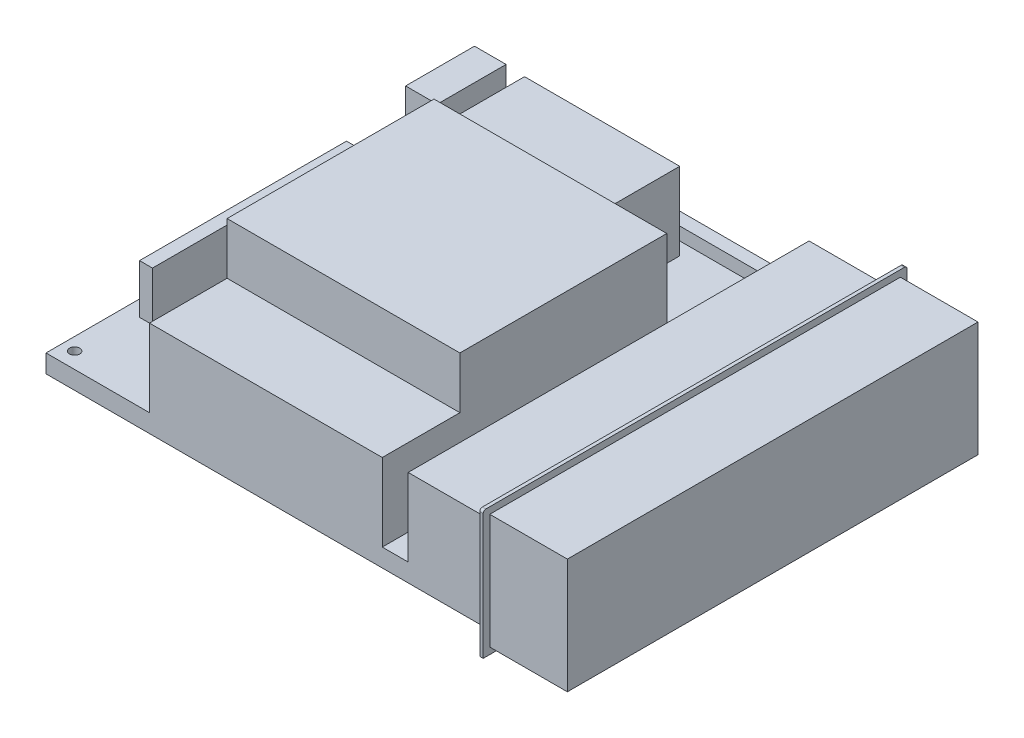
from build123d import *

# Parameters (mm, degrees)
SKETCH1_W                          = 170
SKETCH1_H                          = 170
ALUSPLAAT_DEPTH                    = 2
SKETCH2_W                          = 30
SKETCH2_H                          = 155
PISTIKUD_DEPTH                     = 35
SKETCH3_W                          = 90
SKETCH3_H                          = 110
CPU_M_LUD_DEPTH                    = 55
SKETCH4_W                          = 60
SKETCH4_H                          = 35
SININE_RADIKAS_DEPTH               = 35
SKETCH5_W                          = 90
SKETCH5_H                          = 5
PCIE_PESA_DEPTH                    = 10
SKETCH6_W                          = 12.216790721
SKETCH6_H                          = 26.62710746
RAID_PESAD_DEPTH                   = 30
SKETCH7_W                          = 170
SKETCH7_H                          = 170
LE_LDINE_M_RA_DEPTH                = 5
SKETCH8_W                          = 5
SKETCH8_H                          = 80
PATREI_JA_IGASUGUSED_L_LITID_DEPTH = 19
SKETCH9_OUTSIDE_W                  = 221.416
SKETCH9_OUTSIDE_H                  = 221.416
SKETCH9_OUTSIDE_W_2                = 90
SKETCH9_OUTSIDE_H_2                = 80
M_LUD_DEPTH                        = 20
CUT_EXTRUDE2_REACH                 = 132.192
SKETCH10_R                         = 1.98
BOSS_EXTRUDE1_DEPTH                = 1.32
SKETCH12_W                         = 158.75
SKETCH12_H                         = 44.45
BOSS_EXTRUDE2_DEPTH                = 30


with BuildPart() as part:
    # Sketch1 → alusplaat (new body)
    with BuildSketch(Plane(origin=(0, 0, 0), x_dir=(1, 0, 0), z_dir=(0, 1, 0))):
        Rectangle(SKETCH1_W, SKETCH1_H)
    extrude(amount=ALUSPLAAT_DEPTH)

    # Sketch2 → pistikud (add)
    with BuildSketch(Plane(origin=(0, 2, 0), x_dir=(-1, 0, 0), z_dir=(0, 1, 0))):
        with Locations((-70, 7.5)):
            Rectangle(SKETCH2_W, SKETCH2_H)
    extrude(amount=PISTIKUD_DEPTH)

    # Sketch3 → cpu+mälud (add)
    with BuildSketch(Plane(origin=(0, 2, 0), x_dir=(1, 0, 0), z_dir=(0, 1, 0))):
        with Locations((0, -30)):
            Rectangle(SKETCH3_W, SKETCH3_H)
    extrude(amount=CPU_M_LUD_DEPTH)

    # Sketch4 → sinine radikas (add)
    with BuildSketch(Plane(origin=(0, 2, 0), x_dir=(1, 0, 0), z_dir=(0, 1, 0))):
        with Locations((-25, 52.5)):
            Rectangle(SKETCH4_W, SKETCH4_H)
    extrude(amount=SININE_RADIKAS_DEPTH)

    # Sketch5 → pcie pesa (add)
    with BuildSketch(Plane(origin=(0, 2, 0), x_dir=(-1, 0, 0), z_dir=(0, 1, 0))):
        with Locations((0, -77.5)):
            Rectangle(SKETCH5_W, SKETCH5_H)
    extrude(amount=PCIE_PESA_DEPTH)

    # Sketch6 → raid pesad (add)
    with BuildSketch(Plane(origin=(0, 2, 0), x_dir=(-1, 0, 0), z_dir=(0, 1, 0))):
        with Locations((73.780405742, -62.225935716)):
            Rectangle(SKETCH6_W, SKETCH6_H)
    extrude(amount=RAID_PESAD_DEPTH)

    # Sketch7 → üleüldine müra (add)
    with BuildSketch(Plane(origin=(0, 2, 0), x_dir=(-1, 0, 0), z_dir=(0, 1, 0))):
        Rectangle(SKETCH7_W, SKETCH7_H)
    extrude(amount=LE_LDINE_M_RA_DEPTH)

    # Sketch8 → patrei ja igasugused lülitid (add)
    with BuildSketch(Plane(origin=(0, 7, 0), x_dir=(-1, 0, 0), z_dir=(0, 1, 0))):
        with Locations((76.340130234, 15)):
            Rectangle(SKETCH8_W, SKETCH8_H)
    extrude(amount=PATREI_JA_IGASUGUSED_L_LITID_DEPTH)

    # Sketch9 outside → mälud (cut)
    with BuildSketch(Plane(origin=(0, 57, 0), x_dir=(-1, 0, 0), z_dir=(0, 1, 0))):
        Rectangle(SKETCH9_OUTSIDE_W, SKETCH9_OUTSIDE_H)
        with Locations((0, 15)):
            Rectangle(SKETCH9_OUTSIDE_W_2, SKETCH9_OUTSIDE_H_2, mode=Mode.SUBTRACT)
    extrude(amount=-M_LUD_DEPTH, mode=Mode.SUBTRACT)

    # Sketch10 → Cut-Extrude2 (cut, up to next)
    with BuildSketch(Plane(origin=(0, 7, 0), x_dir=(1, 0, 0), z_dir=(0, 1, 0)), mode=Mode.PRIVATE) as cut_extrude2_sk1:
        with Locations((74.84, 78.65)):
            Circle(SKETCH10_R)
    cut_extrude2_tool1 = extrude(cut_extrude2_sk1.sketch, amount=-CUT_EXTRUDE2_REACH, mode=Mode.PRIVATE) & part.part
    # Sketch10 → Cut-Extrude2 (cut, up to next)
    with BuildSketch(Plane(origin=(0, 7, 0), x_dir=(1, 0, 0), z_dir=(0, 1, 0)), mode=Mode.PRIVATE) as cut_extrude2_sk2:
        with Locations((-80.1, 78.65)):
            Circle(SKETCH10_R)
    cut_extrude2_tool2 = extrude(cut_extrude2_sk2.sketch, amount=-CUT_EXTRUDE2_REACH, mode=Mode.PRIVATE) & part.part
    # Sketch10 → Cut-Extrude2 (cut, up to next)
    with BuildSketch(Plane(origin=(0, 7, 0), x_dir=(1, 0, 0), z_dir=(0, 1, 0)), mode=Mode.PRIVATE) as cut_extrude2_sk3:
        with Locations((-80.1, -78.83)):
            Circle(SKETCH10_R)
    cut_extrude2_tool3 = extrude(cut_extrude2_sk3.sketch, amount=-CUT_EXTRUDE2_REACH, mode=Mode.PRIVATE) & part.part
    # Sketch10 → Cut-Extrude2 (cut, up to next)
    with BuildSketch(Plane(origin=(0, 7, 0), x_dir=(1, 0, 0), z_dir=(0, 1, 0)), mode=Mode.PRIVATE) as cut_extrude2_sk4:
        with Locations((51.98, -78.83)):
            Circle(SKETCH10_R)
    cut_extrude2_tool4 = extrude(cut_extrude2_sk4.sketch, amount=-CUT_EXTRUDE2_REACH, mode=Mode.PRIVATE) & part.part
    add(cut_extrude2_tool1.solids().sort_by_distance((74.84, 7, -78.65))[0], mode=Mode.SUBTRACT)
    add(cut_extrude2_tool2.solids().sort_by_distance((-80.1, 7, -78.65))[0], mode=Mode.SUBTRACT)
    add(cut_extrude2_tool3.solids().sort_by_distance((-80.1, 7, 78.83))[0], mode=Mode.SUBTRACT)
    add(cut_extrude2_tool4.solids().sort_by_distance((51.98, 7, 78.83))[0], mode=Mode.SUBTRACT)


with BuildPart() as body_2:
    # Sketch11 → Boss-Extrude1 (new body)
    with BuildSketch(Plane(origin=(87.11, 0, 0), x_dir=(0, 0, -1), z_dir=(1, 0, 0))):
        with BuildLine():
            Line((-88.415, 43.18), (73.415, 43.18))
            ThreePointArc((73.415, 43.18), (74.122106781, 42.887106781), (74.415, 42.18))
            Line((74.415, 42.18), (74.415, -5.35))
            ThreePointArc((74.415, -5.35), (74.122106781, -6.057106781), (73.415, -6.35))
            Line((73.415, -6.35), (-89.415, -6.35))
            Line((-89.415, -6.35), (-89.415, 42.18))
            ThreePointArc((-89.415, 42.18), (-89.122106781, 42.887106781), (-88.415, 43.18))
        make_face()
    extrude(amount=BOSS_EXTRUDE1_DEPTH)


with BuildPart() as body_3:
    # Sketch12 → Boss-Extrude2 (new body)
    with BuildSketch(Plane(origin=(88.43, 0, 0), x_dir=(0, 0, -1), z_dir=(1, 0, 0))):
        with Locations((-7.5, 18.415)):
            Rectangle(SKETCH12_W, SKETCH12_H)
    extrude(amount=BOSS_EXTRUDE2_DEPTH)


solid = Compound([part.part, body_2.part, body_3.part])
